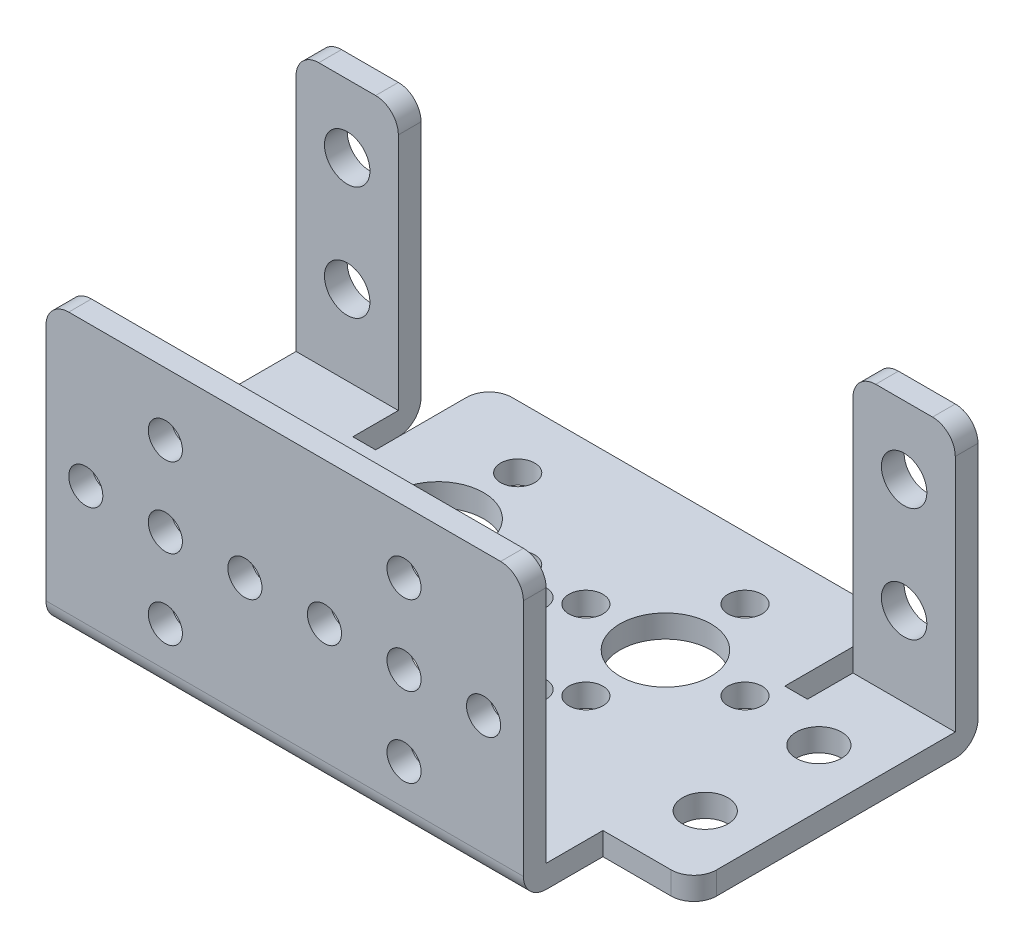
from build123d import *

# Parameters (mm, degrees)
SKETCH1_W           = 42
SKETCH1_H           = 25
SKETCH1_R           = 1.5
BOSS_EXTRUDE1_DEPTH = 2
SKETCH2_R           = 2
SKETCH2_R_2         = 4
SKETCH2_R_3         = 1.5
BOSS_EXTRUDE2_DEPTH = 2
CUT_EXTRUDE1_DEPTH  = 2
FILLET1_R           = 2
FILLET2_R           = 2
FILLET3_R           = 2
FILLET4_R           = 2
FILLET5_R           = 2
BOSS_EXTRUDE3_DEPTH = 2
FILLET6_R           = 2
FILLET7_R           = 2
SKETCH5_R           = 2
CUT_EXTRUDE2_DEPTH  = 2


with BuildPart() as part:
    # Sketch1 → Boss-Extrude1 (new body)
    with BuildSketch(Plane.XY):
        with Locations((21, 12.5)):
            Rectangle(SKETCH1_W, SKETCH1_H)
        with Locations((10.5, 12.5)):
            Circle(SKETCH1_R, mode=Mode.SUBTRACT)
        with Locations((10.5, 19.5)):
            Circle(SKETCH1_R, mode=Mode.SUBTRACT)
        with Locations((17.5, 12.5)):
            Circle(SKETCH1_R, mode=Mode.SUBTRACT)
        with Locations((3.5, 12.5)):
            Circle(SKETCH1_R, mode=Mode.SUBTRACT)
        with Locations((10.5, 5.5)):
            Circle(SKETCH1_R, mode=Mode.SUBTRACT)
        with Locations((31.5, 12.5)):
            Circle(SKETCH1_R, mode=Mode.SUBTRACT)
        with Locations((38.5, 12.5)):
            Circle(SKETCH1_R, mode=Mode.SUBTRACT)
        with Locations((31.5, 19.5)):
            Circle(SKETCH1_R, mode=Mode.SUBTRACT)
        with Locations((24.5, 12.5)):
            Circle(SKETCH1_R, mode=Mode.SUBTRACT)
        with Locations((31.5, 5.5)):
            Circle(SKETCH1_R, mode=Mode.SUBTRACT)
    extrude(amount=-BOSS_EXTRUDE1_DEPTH)

    # Sketch2 → Boss-Extrude2 (add)
    with BuildSketch(Plane.XZ):
        with BuildLine():
            Line((0, -32), (0, -36))
            Line((0, -36), (42, -36))
            Line((42, -36), (42, -32))
            Line((42, -32), (50, -32))
            Line((50, -32), (50, -9))
            ThreePointArc((50, -9), (49.414213562, -7.585786438), (48, -7))
            Line((48, -7), (42, -7))
            Line((42, -7), (42, 0))
            Line((42, 0), (0, 0))
            Line((0, 0), (0, -7))
            Line((0, -7), (-6, -7))
            ThreePointArc((-6, -7), (-7.414213562, -7.585786438), (-8, -9))
            Line((-8, -9), (-8, -32))
            Line((-8, -32), (0, -32))
        make_face()
        with Locations((45, -13)):
            Circle(SKETCH2_R, mode=Mode.SUBTRACT)
        with Locations((45, -23)):
            Circle(SKETCH2_R, mode=Mode.SUBTRACT)
        with Locations((-3, -13)):
            Circle(SKETCH2_R, mode=Mode.SUBTRACT)
        with Locations((-3, -23)):
            Circle(SKETCH2_R, mode=Mode.SUBTRACT)
        with Locations((11, -23.5)):
            Circle(SKETCH2_R_2, mode=Mode.SUBTRACT)
        with Locations((31, -23.5)):
            Circle(SKETCH2_R_2, mode=Mode.SUBTRACT)
        with Locations((21, -14.5)):
            Circle(SKETCH2_R_2, mode=Mode.SUBTRACT)
        with Locations((11, -16.5)):
            Circle(SKETCH2_R_3, mode=Mode.SUBTRACT)
        with Locations((11, -30.5)):
            Circle(SKETCH2_R_3, mode=Mode.SUBTRACT)
        with Locations((18, -23.5)):
            Circle(SKETCH2_R_3, mode=Mode.SUBTRACT)
        with Locations((4, -23.5)):
            Circle(SKETCH2_R_3, mode=Mode.SUBTRACT)
        with Locations((31, -30.5)):
            Circle(SKETCH2_R_3, mode=Mode.SUBTRACT)
        with Locations((24, -23.5)):
            Circle(SKETCH2_R_3, mode=Mode.SUBTRACT)
        with Locations((31, -16.5)):
            Circle(SKETCH2_R_3, mode=Mode.SUBTRACT)
        with Locations((38, -23.5)):
            Circle(SKETCH2_R_3, mode=Mode.SUBTRACT)
        with Locations((21, -21.5)):
            Circle(SKETCH2_R_3, mode=Mode.SUBTRACT)
        with Locations((21, -7.5)):
            Circle(SKETCH2_R_3, mode=Mode.SUBTRACT)
        with Locations((28, -14.5)):
            Circle(SKETCH2_R_3, mode=Mode.SUBTRACT)
        with Locations((14, -14.5)):
            Circle(SKETCH2_R_3, mode=Mode.SUBTRACT)
    extrude(amount=-BOSS_EXTRUDE2_DEPTH)

    # Sketch3 → Cut-Extrude1 (cut)
    with BuildSketch(Plane.XZ):
        Polygon((39, -36), (39, -26), (41, -26), (41, -32), (42, -32), (42, -36), align=None)
    cut_extrude1 = extrude(amount=-CUT_EXTRUDE1_DEPTH, mode=Mode.SUBTRACT)

    # Mirror1: Cut-Extrude1 across plane
    add(cut_extrude1.mirror(Plane(origin=(21, 0, 0), x_dir=(0, 0, 1), z_dir=(1, 0, 0))), mode=Mode.SUBTRACT)

    # Fillet1
    fillet1_edges = [part.edges().sort_by_distance(p)[0] for p in [
        (3, 1, -36),
    ]]
    fillet(fillet1_edges, radius=FILLET1_R)

    # Fillet2
    fillet2_edges = [part.edges().sort_by_distance(p)[0] for p in [
        (39, 1, -36),
    ]]
    fillet(fillet2_edges, radius=FILLET2_R)

    # Fillet3
    fillet3_edges = [part.edges().sort_by_distance(p)[0] for p in [
        (21, 0, 0),
    ]]
    fillet(fillet3_edges, radius=FILLET3_R)

    # Fillet4
    fillet4_edges = [part.edges().sort_by_distance(p)[0] for p in [
        (42, 25, -1),
    ]]
    fillet(fillet4_edges, radius=FILLET4_R)

    # Fillet5
    fillet5_edges = [part.edges().sort_by_distance(p)[0] for p in [
        (0, 25, -1),
    ]]
    fillet(fillet5_edges, radius=FILLET5_R)

    # Sketch4 → Boss-Extrude3 (add)
    with BuildSketch(Plane(origin=(0, 0, -32), x_dir=(-1, 0, 0), z_dir=(0, 0, -1))):
        with BuildLine():
            Line((8, 0), (-1, 0))
            Line((-1, 0), (-1, 23))
            ThreePointArc((-1, 23), (-0.414213562, 24.414213562), (1, 25))
            Line((1, 25), (6, 25))
            ThreePointArc((6, 25), (7.414213562, 24.414213562), (8, 23))
            Line((8, 23), (8, 0))
        make_face()
    boss_extrude3 = extrude(amount=-BOSS_EXTRUDE3_DEPTH)

    # Mirror2: Boss-Extrude3 across plane
    add(boss_extrude3.mirror(Plane(origin=(21, 0, 0), x_dir=(0, 0, 1), z_dir=(1, 0, 0))))

    # Fillet6
    fillet6_edges = [part.edges().sort_by_distance(p)[0] for p in [
        (45.5, 0, -32),
    ]]
    fillet(fillet6_edges, radius=FILLET6_R)

    # Fillet7
    fillet7_edges = [part.edges().sort_by_distance(p)[0] for p in [
        (-3.5, 0, -32),
    ]]
    fillet(fillet7_edges, radius=FILLET7_R)

    # Sketch5 → Cut-Extrude2 (cut)
    with BuildSketch(Plane(origin=(0, 0, -32), x_dir=(-1, 0, 0), z_dir=(0, 0, -1))):
        with Locations((3.5, 19)):
            Circle(SKETCH5_R)
        with Locations((3.5, 9)):
            Circle(SKETCH5_R)
    cut_extrude2 = extrude(amount=-CUT_EXTRUDE2_DEPTH, mode=Mode.SUBTRACT)

    # Mirror3: Cut-Extrude2 across plane
    add(cut_extrude2.mirror(Plane(origin=(21, 0, 0), x_dir=(0, 0, 1), z_dir=(1, 0, 0))), mode=Mode.SUBTRACT)


solid = part.part
